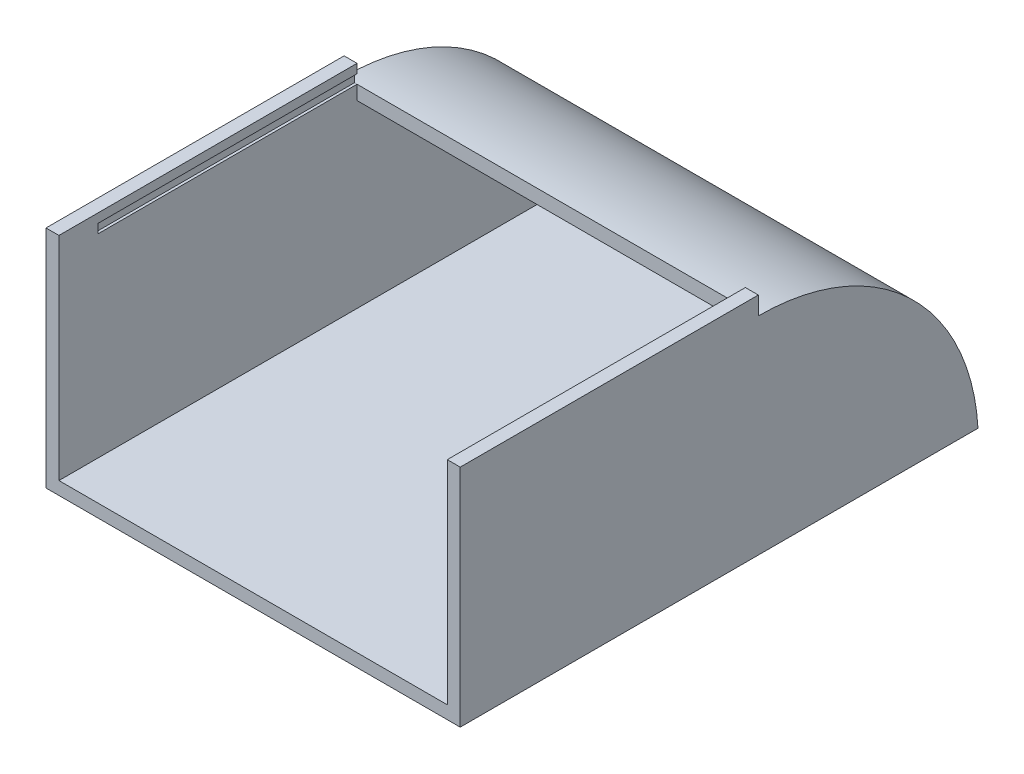
from build123d import *

# Parameters (mm, degrees)
SKETCH1_W           = 200
SKETCH1_H           = 80
BOSS_EXTRUDE1_DEPTH = 80
SKETCH2_W           = 150
SKETCH2_H           = 70
CUT_EXTRUDE2_DEPTH  = 190
FILLET5_R           = 85
CUT_EXTRUDE6_DEPTH  = 10
SKETCH9_W           = 5
SKETCH9_H           = 115.147186258
BOSS_EXTRUDE2_DEPTH = 7
SKETCH10_W          = 5
SKETCH10_H          = 115.147186258
BOSS_EXTRUDE3_DEPTH = 7
SKETCH13_W          = 100
SKETCH13_H          = 3.5
CUT_EXTRUDE9_DEPTH  = 1
SKETCH14_W          = 100
SKETCH14_H          = 3.5
CUT_EXTRUDE10_DEPTH = 1


with BuildPart() as part:
    # Sketch1 → Boss-Extrude1 (new, symmetric)
    with BuildSketch(Plane(origin=(0, 0, 0), x_dir=(0, 0, -1), z_dir=(1, 0, 0))):
        Rectangle(SKETCH1_W, SKETCH1_H)
    extrude(amount=BOSS_EXTRUDE1_DEPTH, both=True)

    # Sketch2 → Cut-Extrude2 (cut)
    with BuildSketch(Plane.XY.offset(100)):
        Rectangle(SKETCH2_W, SKETCH2_H)
    extrude(amount=-CUT_EXTRUDE2_DEPTH, mode=Mode.SUBTRACT)

    # Fillet5
    # the kernel refuses this fillet: 85 mm, written as the material it adds along each edge
    with BuildSketch(Plane(origin=(-75, 35, -90), x_dir=(0, 0, 1), z_dir=(1, 0, 0))) as fillet5_piece_1:
        with BuildLine():
            CenterArc((83.666002653, 85), FILLET5_R, 190.164248622, 79.835751378)
            Line((0, 70), (-1.673320053, 69.7))
            ThreePointArc((-1.673320053, 69.7), (-1.7, 35), (-1.7, 0))
            Line((-1.7, 0), (0, -1.7))
            Line((0, -1.7), (83.666002653, -1.7))
            Line((83.666002653, -1.7), (83.666002653, 0))
        make_face()
    extrude(amount=150)
    # the kernel refuses this fillet: 85 mm, written as the material it takes off along each edge
    with BuildSketch(Plane(origin=(-292.132034356, 40, -100), x_dir=(0, -1, 0), z_dir=(1, 0, 0))) as fillet5_2_piece_1:
        with BuildLine():
            CenterArc((85, -84.852813742), FILLET5_R, 93.372286683, 86.627713317)
            Line((0, -84.852813742), (-1.7, -84.852813742))
            Line((-1.7, -84.852813742), (-1.7, 0))
            Line((-1.7, 0), (0, 1.7))
            ThreePointArc((0, 1.7), (40, 1.7), (79.9, 1.697056275))
            Line((79.9, 1.697056275), (80, 0))
        make_face()
    extrude(amount=584.264068712, mode=Mode.SUBTRACT)

    # Sketch8 → Cut-Extrude6 (cut)
    with BuildSketch(Plane(origin=(0, 40, 0), x_dir=(1, 0, 0), z_dir=(0, 1, 0))):
        Polygon((0, 15.147186258), (-75, 15.147186258), (-75, -100), (75, -100), (75, 15.147186258), align=None)
    extrude(amount=-CUT_EXTRUDE6_DEPTH, mode=Mode.SUBTRACT)

    # Sketch9 → Boss-Extrude2 (add)
    with BuildSketch(Plane(origin=(0, 40, 0), x_dir=(1, 0, 0), z_dir=(0, 1, 0))):
        with Locations((-77.5, -42.426406871)):
            Rectangle(SKETCH9_W, SKETCH9_H)
    extrude(amount=BOSS_EXTRUDE2_DEPTH)

    # Sketch10 → Boss-Extrude3 (add)
    with BuildSketch(Plane(origin=(0, 40, 0), x_dir=(1, 0, 0), z_dir=(0, 1, 0))):
        with Locations((77.5, -42.426406871)):
            Rectangle(SKETCH10_W, SKETCH10_H)
    extrude(amount=BOSS_EXTRUDE3_DEPTH)

    # Sketch13 → Cut-Extrude9 (cut)
    with BuildSketch(Plane(origin=(-75, 0, 0), x_dir=(0, 0, -1), z_dir=(1, 0, 0))):
        with Locations((-34.852813742, 41.75)):
            Rectangle(SKETCH13_W, SKETCH13_H)
    extrude(amount=-CUT_EXTRUDE9_DEPTH, mode=Mode.SUBTRACT)

    # Sketch14 → Cut-Extrude10 (cut)
    with BuildSketch(Plane.ZY.offset(-75)):
        with Locations((34.852813742, 41.75)):
            Rectangle(SKETCH14_W, SKETCH14_H)
    extrude(amount=-CUT_EXTRUDE10_DEPTH, mode=Mode.SUBTRACT)


solid = part.part
